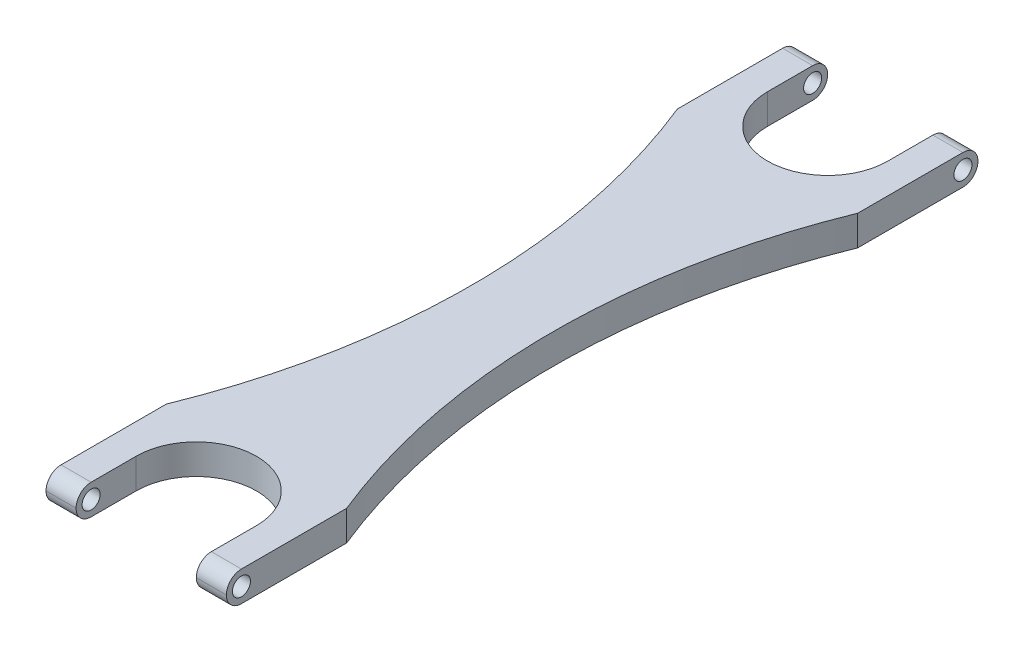
from build123d import *

# Parameters (mm, degrees)
BOSS_EXTRUDE1_DEPTH = 12.7
FILLET1_R           = 6.35
SKETCH2_R           = 3.81
CUT_EXTRUDE1_DEPTH  = 327.762880389
SKETCH3_R           = 3.81
CUT_EXTRUDE2_DEPTH  = 327.762880389


with BuildPart() as part:
    # Sketch1 → Boss-Extrude1 (new body)
    with BuildSketch(Plane(origin=(0, 0, 0), x_dir=(1, 0, 0), z_dir=(0, 1, 0))):
        with BuildLine():
            Line((0, 0), (12.7, 0))
            Line((12.7, 0), (12.7, -25.4))
            ThreePointArc((12.7, -25.4), (20.139487758, -43.360512242), (38.1, -50.8))
            ThreePointArc((38.1, -50.8), (56.060512242, -43.360512242), (63.5, -25.4))
            Line((63.5, -25.4), (63.5, 0))
            Line((63.5, 0), (76.2, 0))
            Line((76.2, 0), (76.2, -50.8))
            ThreePointArc((76.2, -50.8), (55.181226716, -158.75), (76.2, -266.7))
            Line((76.2, -266.7), (76.2, -317.5))
            Line((76.2, -317.5), (63.5, -317.5))
            Line((63.5, -317.5), (63.5, -292.1))
            ThreePointArc((63.5, -292.1), (56.060512242, -274.139487758), (38.1, -266.7))
            ThreePointArc((38.1, -266.7), (20.139487758, -274.139487758), (12.7, -292.1))
            Line((12.7, -292.1), (12.7, -317.5))
            Line((12.7, -317.5), (0, -317.5))
            Line((0, -317.5), (0, -266.7))
            ThreePointArc((0, -266.7), (21.018773284, -158.75), (0, -50.8))
            Line((0, -50.8), (0, 0))
        make_face()
    extrude(amount=BOSS_EXTRUDE1_DEPTH)

    # Fillet1
    fillet1_edges = [part.edges().sort_by_distance(p)[0] for p in [
        (69.85, 0, 0),
        (6.35, 0, 0),
        (69.85, 12.7, 0),
        (6.35, 12.7, 0),
        (6.35, 0, 317.5),
        (6.35, 12.7, 317.5),
        (69.85, 0, 317.5),
        (69.85, 12.7, 317.5),
    ]]
    fillet(fillet1_edges, radius=FILLET1_R - 0.0001)  # a hair under: the kernel refuses the full size

    # Sketch2 → Cut-Extrude1 (cut, through all)
    with BuildSketch(Plane(origin=(76.2, 0, 0), x_dir=(0, 0, -1), z_dir=(1, 0, 0))):
        with Locations((-311.15, 6.35)):
            Circle(SKETCH2_R)
    extrude(amount=-CUT_EXTRUDE1_DEPTH, mode=Mode.SUBTRACT)

    # Sketch3 → Cut-Extrude2 (cut, through all)
    with BuildSketch(Plane(origin=(76.2, 0, 0), x_dir=(0, 0, -1), z_dir=(1, 0, 0))):
        with Locations((-6.35, 6.35)):
            Circle(SKETCH3_R)
    extrude(amount=-CUT_EXTRUDE2_DEPTH, mode=Mode.SUBTRACT)


solid = part.part
